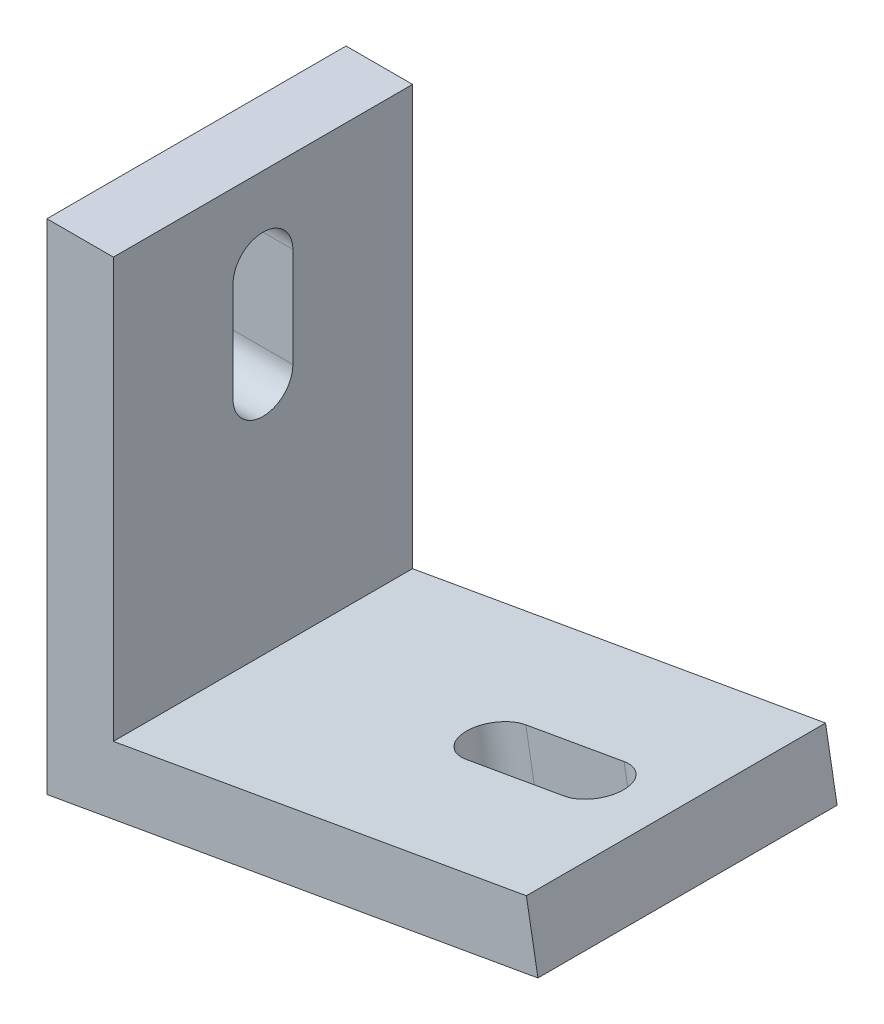
from build123d import *

# Parameters (mm, degrees)
BOSS_EXTRUDE1_DEPTH      = 22.5
M8_CLEARANCE_SLOT1_DEPTH = 10


# Read off the part's stored shape, not the designer's step: M8 Clearance Slot1
with BuildPart() as part:
    # Sketch1 → Boss-Extrude1 (new, symmetric)
    with BuildSketch(Plane.XY):
        Polygon((0, 0), (73.860581476, 13.023613325), (72.124099699, 22.871690855), (10, 11.917535926), (10, 75), (0, 75), align=None)
    extrude(amount=BOSS_EXTRUDE1_DEPTH, both=True)

    # M8 Clearance Slot1 outline → M8 Clearance Slot1 (cut)
    with BuildSketch(Plane.YZ):
        with BuildLine():
            ThreePointArc((62.5, -4.5), (67, 0), (62.5, 4.5))
            Line((62.5, 4.5), (47.5, 4.5))
            ThreePointArc((47.5, 4.5), (43, 0), (47.5, -4.5))
            Line((47.5, -4.5), (62.5, -4.5))
        make_face()
    m8_clearance_slot1 = extrude(amount=M8_CLEARANCE_SLOT1_DEPTH, mode=Mode.SUBTRACT)

    # Mirror1: M8 Clearance Slot1 across plane
    add(m8_clearance_slot1.mirror(Plane(origin=(0, 0, 0), x_dir=(0, 0, 1), z_dir=(0.7660444431189772, -0.6427876096865405, 0))), mode=Mode.SUBTRACT)


solid = part.part
